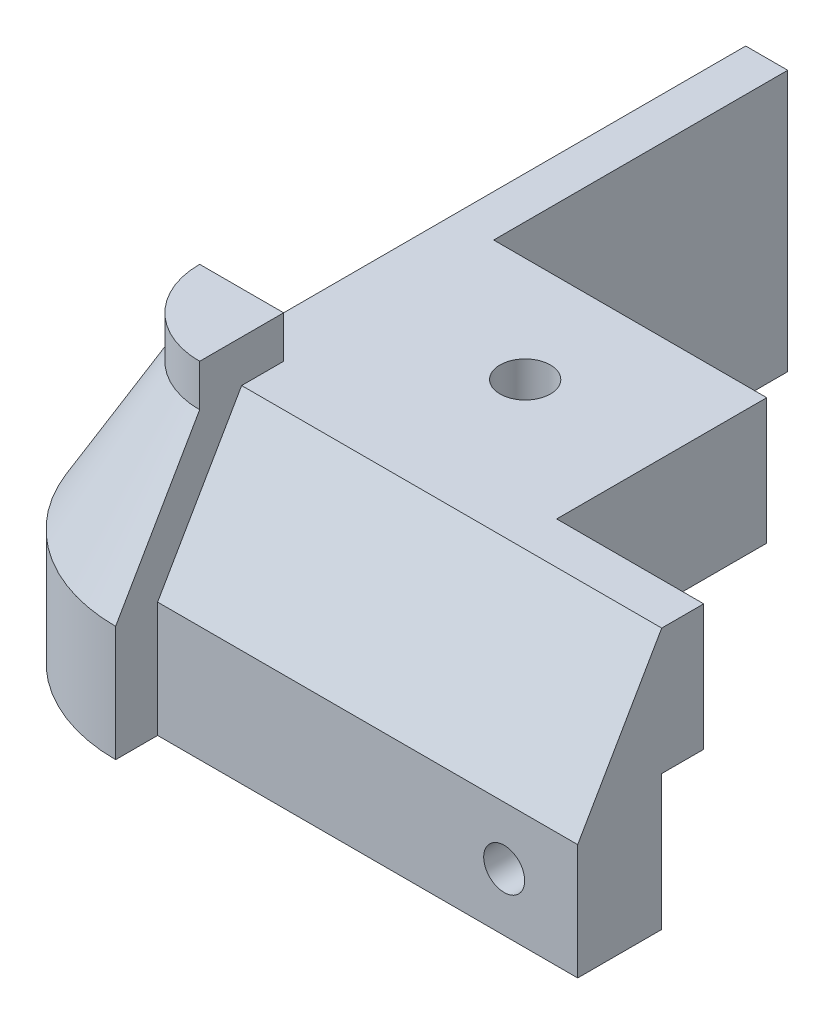
from build123d import *

# Parameters (mm, degrees)
SKETCH_1_W               = 13
SKETCH_1_H               = 10
SKETCH_1_R               = 1.2
EXTRUDE_1_DEPTH          = 6
EXTRUDE_2_DEPTH          = 24
EXTRUDE_7_DEPTH          = 20
CUT_EXTRUDE_1_DEPTH      = 33.837810475
CUT_EXTRUDE_1_DEPTH_BACK = 33.837810475
SKETCH_5_R               = 0.975
SKETCH_6_R               = 0.975
CUT_EXTRUDE_2_DEPTH      = 34.519722504
SWEEP_1_ANGLE            = 90


# Read off the part's stored shape, not the designer's step: ｽｲｰﾌﾟ1
with BuildPart() as part:
    # ｽｹｯﾁ1 → ﾎﾞｽ - 押し出し1 (new body)
    with BuildSketch(Plane(origin=(0, 0, 0), x_dir=(1, 0, 0), z_dir=(0, 1, 0))):
        Rectangle(SKETCH_1_W, SKETCH_1_H)
        with Locations(Location((0, 0, 0), (0, 0, 270))):
            Circle(SKETCH_1_R, mode=Mode.SUBTRACT)
    extrude(amount=EXTRUDE_1_DEPTH)

    # ｽｹｯﾁ2 → ﾎﾞｽ - 押し出し2 (add)
    with BuildSketch(Plane.XY.offset(5)):
        Polygon((-6.5, 6), (-8.5, 6), (-12.5, -0.92820323), (-12.5, -6.42820323), (-6.5, -6.42820323), align=None)
    extrude(amount=-EXTRUDE_2_DEPTH)

    # ｽｹｯﾁ4 → ﾎﾞｽ - 押し出し7 (add)
    with BuildSketch(Plane(origin=(-6.5, 0, 0), x_dir=(0, 0, -1), z_dir=(1, 0, 0))):
        Polygon((-5, 6), (-7, 6), (-11, -0.92820323), (-11, -6.42820323), (-7, -6.42820323), (-7, 0), (-5, 0), align=None)
    extrude(amount=EXTRUDE_7_DEPTH)

    # ｽｹｯﾁ5 → ｶｯﾄ - 押し出し1 (cut, two sides: drawn at the far end of the back side and taken through both)
    with BuildSketch(Plane.ZY.offset(12.5).offset(-CUT_EXTRUDE_1_DEPTH_BACK)):
        with Locations((-13.15, -3.67820323)):
            Circle(SKETCH_5_R)
    extrude(amount=CUT_EXTRUDE_1_DEPTH + CUT_EXTRUDE_1_DEPTH_BACK, mode=Mode.SUBTRACT)

    # ｽｹｯﾁ6 → ｶｯﾄ - 押し出し2 (cut, through all)
    with BuildSketch(Plane.XY.offset(11)):
        with Locations((10, -3.67820323)):
            Circle(SKETCH_6_R)
    extrude(amount=-CUT_EXTRUDE_2_DEPTH, mode=Mode.SUBTRACT)

    # ｽｲｰﾌﾟ1 outline → ｽｲｰﾌﾟ1 (revolve)
    with BuildSketch(Plane(origin=(-6.5, 0, 5), x_dir=(-1, 0, 0), z_dir=(0, 0, -1))):
        Polygon((0, 8), (0, -6.42820323), (8, -6.42820323), (8, -0.92820323), (4, 6), (4, 8), align=None)
    revolve(axis=Axis((-6.5, 0, 5), (0, 1, 0)), revolution_arc=SWEEP_1_ANGLE)


solid = part.part
